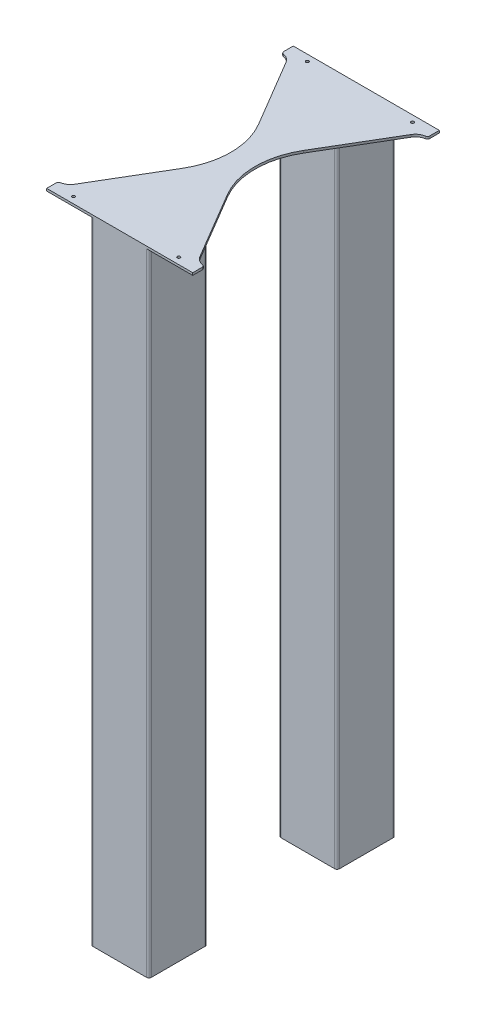
from build123d import *

# Parameters (mm, degrees)
SKETCH1_R           = 1.5875
BOSS_EXTRUDE1_DEPTH = 2.54
SKETCH2_W           = 63.5
SKETCH2_H           = 63.5
BOSS_EXTRUDE2_DEPTH = 685.8
SHELL1_START        = -688.34
SHELL1_OUTLINE_W    = 58.42
SHELL1_OUTLINE_H    = 58.42
SHELL1_DEPTH        = 685.8
FILLET1_R           = 2.54
FILLET2_R           = 2.54


# Read off the part's stored shape, not the designer's step: Shell1
with BuildPart() as part:
    # Sketch1 → Boss-Extrude1 (new body)
    with BuildSketch(Plane(origin=(0, 0, 0), x_dir=(1, 0, 0), z_dir=(0, 1, 0))):
        with BuildLine():
            Line((-79.375, -133.985), (79.375, -133.985))
            Line((79.375, -133.985), (79.375, -123.618732018))
            ThreePointArc((79.375, -123.618732018), (78.770533054, -121.973948811), (77.244833229, -121.1120137))
            ThreePointArc((77.244833229, -121.1120137), (71.931312021, -118.98641106), (68.016545719, -114.811929173))
            Line((68.016545719, -114.811929173), (24.542448632, -41.427653291))
            ThreePointArc((24.542448632, -41.427653291), (13.192327388, 0), (24.542448632, 41.427653291))
            Line((24.542448632, 41.427653291), (68.016545719, 114.811929173))
            ThreePointArc((68.016545719, 114.811929173), (71.931312021, 118.98641106), (77.244833229, 121.1120137))
            ThreePointArc((77.244833229, 121.1120137), (78.770533054, 121.973948811), (79.375, 123.618732018))
            Line((79.375, 123.618732018), (79.375, 133.985))
            Line((79.375, 133.985), (-79.375, 133.985))
            Line((-79.375, 133.985), (-79.375, 123.618732018))
            ThreePointArc((-79.375, 123.618732018), (-78.770533054, 121.973948811), (-77.244833229, 121.1120137))
            ThreePointArc((-77.244833229, 121.1120137), (-71.931312021, 118.98641106), (-68.016545719, 114.811929173))
            Line((-68.016545719, 114.811929173), (-24.542448632, 41.427653291))
            ThreePointArc((-24.542448632, 41.427653291), (-13.192327388, 0), (-24.542448632, -41.427653291))
            Line((-24.542448632, -41.427653291), (-68.016545719, -114.811929173))
            ThreePointArc((-68.016545719, -114.811929173), (-71.931312021, -118.98641106), (-77.244833229, -121.1120137))
            ThreePointArc((-77.244833229, -121.1120137), (-78.770533054, -121.973948811), (-79.375, -123.618732018))
            Line((-79.375, -123.618732018), (-79.375, -133.985))
        make_face()
        with Locations(Location((-57.15, 127, 0), (0, 0, 270))):
            Circle(SKETCH1_R, mode=Mode.SUBTRACT)
        with Locations(Location((57.15, 127, 0), (0, 0, 270))):
            Circle(SKETCH1_R, mode=Mode.SUBTRACT)
        with Locations(Location((57.15, -127, 0), (0, 0, 90))):
            Circle(SKETCH1_R, mode=Mode.SUBTRACT)
        with Locations(Location((-57.15, -127, 0), (0, 0, 90))):
            Circle(SKETCH1_R, mode=Mode.SUBTRACT)
    extrude(amount=-BOSS_EXTRUDE1_DEPTH)

    # Sketch2 → Boss-Extrude2 (add)
    with BuildSketch(Plane.XZ.offset(2.54)):
        with Locations((0, -102.235)):
            Rectangle(SKETCH2_W, SKETCH2_H)
        with Locations((0, 102.235)):
            Rectangle(SKETCH2_W, SKETCH2_H)
    extrude(amount=BOSS_EXTRUDE2_DEPTH)

    # Shell1 outline → Shell1 (cut)
    with BuildSketch(Plane(origin=(0, 0, 0), x_dir=(1, 0, 0), z_dir=(0, 1, 0)).offset(SHELL1_START)):
        with Locations((0, 102.235)):
            Rectangle(SHELL1_OUTLINE_W, SHELL1_OUTLINE_H)
        with Locations((0, -102.235)):
            Rectangle(SHELL1_OUTLINE_W, SHELL1_OUTLINE_H)
    extrude(amount=SHELL1_DEPTH, mode=Mode.SUBTRACT)

    # Fillet1
    fillet1_edges = [part.edges().sort_by_distance(p)[0] for p in [
        (31.75, -345.44, 70.485),
        (31.75, -345.44, 133.985),
        (-31.75, -345.44, 133.985),
        (-31.75, -345.44, 70.485),
    ]]
    fillet(fillet1_edges, radius=FILLET1_R)

    # Fillet2
    fillet2_edges = [part.edges().sort_by_distance(p)[0] for p in [
        (-31.75, -345.44, -70.485),
        (-31.75, -345.44, -133.985),
        (31.75, -345.44, -133.985),
        (31.75, -345.44, -70.485),
    ]]
    fillet(fillet2_edges, radius=FILLET2_R)


solid = part.part
